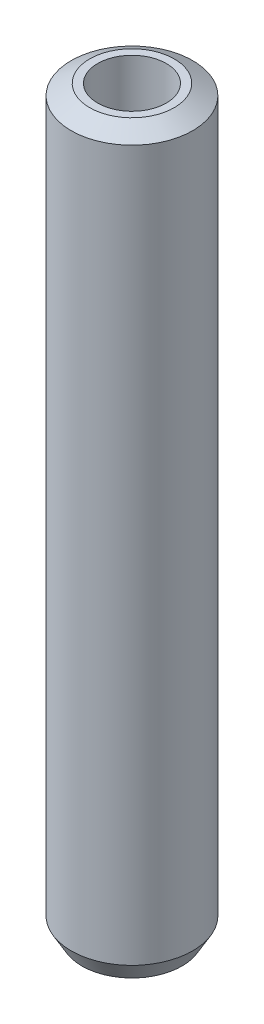
from build123d import *
from OCP.BRepFilletAPI import BRepFilletAPI_MakeChamfer

# Parameters (mm, degrees)
SKETCH1_R           = 7.5
BOSS_EXTRUDE1_DEPTH = 91.265742048
SKETCH2_R           = 4.23706617
CUT_EXTRUDE1_DEPTH  = 92.88000692
CHAMFER1_SIZE       = 1.317519572
CHAMFER1_SIZE2      = 2.282010839


with BuildPart() as part:
    # Sketch1 → Boss-Extrude1 (new body)
    with BuildSketch(Plane(origin=(0, 0, 0), x_dir=(1, 0, 0), z_dir=(0, 1, 0))):
        Circle(SKETCH1_R)
    extrude(amount=BOSS_EXTRUDE1_DEPTH)

    # Sketch2 → Cut-Extrude1 (cut, through all)
    with BuildSketch(Plane(origin=(0, 0, 0), x_dir=(1, 0, 0), z_dir=(0, 1, 0))):
        Circle(SKETCH2_R)
    extrude(amount=CUT_EXTRUDE1_DEPTH, mode=Mode.SUBTRACT)

    # Chamfer1: one chamfer whose edges measure the first distance from different faces: ONE call of the kernel's chamfer builder (chamfer() names one face for all edges)
    chamfer1_edges_1 = [part.edges().sort_by_distance(p)[0] for p in [
        (-7.5, 91.265742048, 0),
    ]]
    chamfer1_side_1 = [part.faces().sort_by_distance(p)[0] for p in [
        (-7.5, 45.632871024, 0),
    ]]
    chamfer1_edges_2 = [part.edges().sort_by_distance(p)[0] for p in [
        (-7.5, 0, 0),
    ]]
    chamfer1_side_2 = [part.faces().sort_by_distance(p)[0] for p in [
        (-7.287867966, 0, 0),
    ]]
    chamfer1 = BRepFilletAPI_MakeChamfer(part.part.solid().wrapped)
    for e in chamfer1_edges_1:
        chamfer1.Add(CHAMFER1_SIZE, CHAMFER1_SIZE2, e.wrapped, chamfer1_side_1[0].wrapped)  # the first distance lies on this face
    for e in chamfer1_edges_2:
        chamfer1.Add(CHAMFER1_SIZE, CHAMFER1_SIZE2, e.wrapped, chamfer1_side_2[0].wrapped)  # the first distance lies on this face
    add(Compound.cast(chamfer1.Shape()), mode=Mode.REPLACE)


solid = part.part
